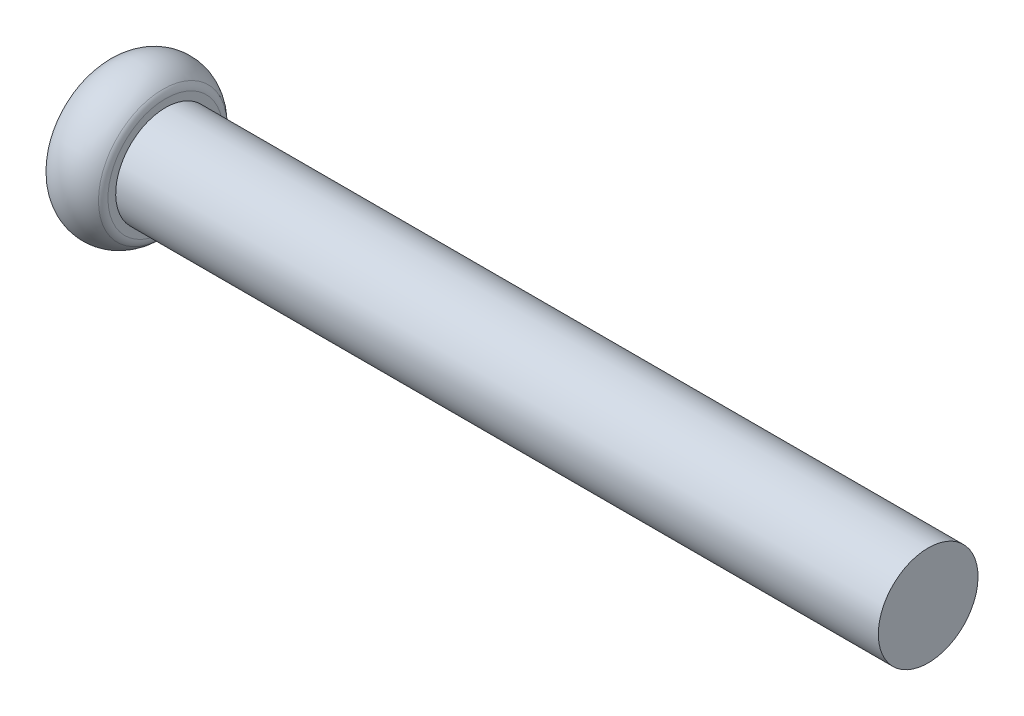
from build123d import *

# Parameters (mm, degrees)
CIRPATTERN1_COUNT = 2
CIRPATTERN1_ANGLE = 90
FILLET1_R         = 0.2


with BuildPart() as part:
    # Sketch1 → Revolve1 (revolve)
    with BuildSketch(Plane.XY):
        with BuildLine():
            Line((1.301883382, 1), (16.6, 1))
            Line((16.6, 1), (16.6, 0))
            Line((16.6, 0), (0, 0))
            Line((0, 0), (0, 0.793494382))
            ThreePointArc((0, 0.793494382), (0.028879068, 0.997099918), (0.113238136, 1.184643945))
            ThreePointArc((0.113238136, 1.184643945), (0.696476275, 1.519551582), (1.301883382, 1.22661458))
            Line((1.301883382, 1.22661458), (1.301883382, 1))
        make_face()
    revolve(axis=Axis((22.144755704, 0, 0), (-1, 0, 0)))

    # Sketch2 → Cut-Loft1 section 0
    with BuildSketch(Plane.ZY):
        with BuildLine():
            Line((-0.3, -1.175), (0.3, -1.175))
            Line((0.3, -1.175), (0.3, 1.175))
            Line((0.3, 1.175), (-0.3, 1.175))
            Line((-0.3, 1.175), (-0.3, -1.175))
        make_face()
    # Sketch3 → Cut-Loft1 section 1
    with BuildSketch(Plane(origin=(1.301883382, 0, 0), x_dir=(0, 0, -1), z_dir=(1, 0, 0))):
        with BuildLine():
            Line((0.35, -0.44201414), (-0.35, -0.44201414))
            Line((-0.35, -0.44201414), (-0.35, 0.44201414))
            Line((-0.35, 0.44201414), (0.35, 0.44201414))
            Line((0.35, 0.44201414), (0.35, -0.44201414))
        make_face()
    cut_loft1 = loft(mode=Mode.SUBTRACT)

    # CirPattern1: Cut-Loft1 ×2 about axis
    cirpattern1_axis = Axis((22.144755704, 0, 0), (-1, 0, 0))
    for i in range(1, CIRPATTERN1_COUNT):
        add(cut_loft1.rotate(cirpattern1_axis, i * CIRPATTERN1_ANGLE / (CIRPATTERN1_COUNT - 1)), mode=Mode.SUBTRACT)

    # Fillet1
    fillet1_edges = [part.edges().sort_by_distance(p)[0] for p in [
        (1.301883382, -1.22661458, 0),
    ]]
    fillet(fillet1_edges, radius=FILLET1_R)


solid = part.part
